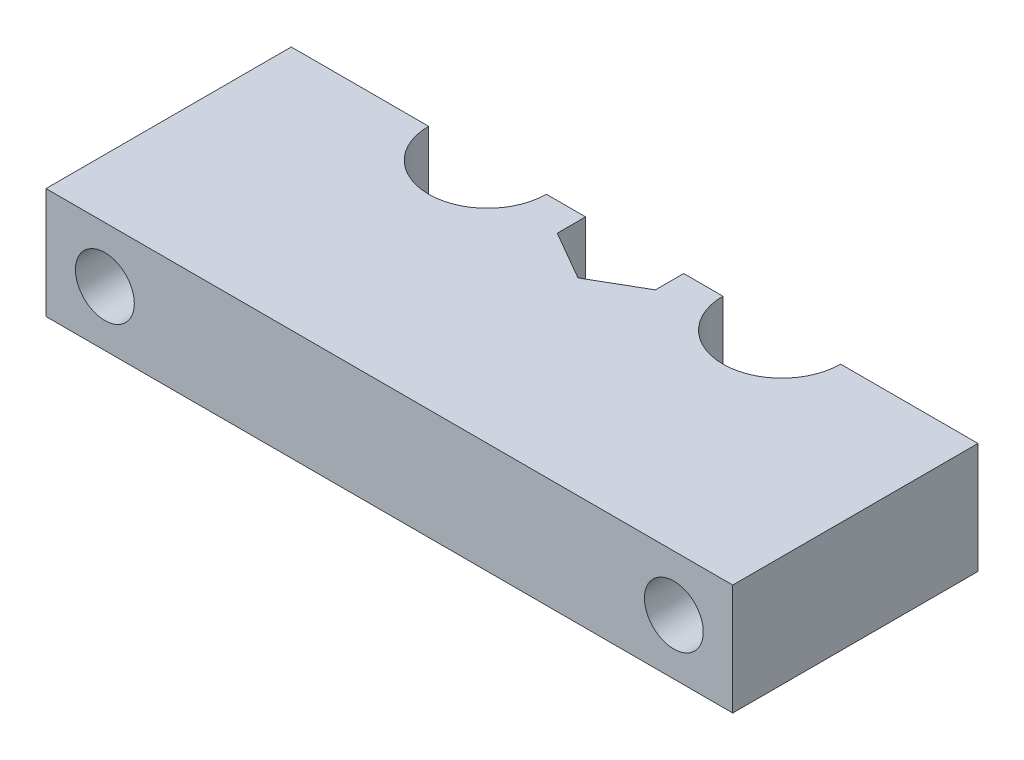
from build123d import *

# Parameters (mm, degrees)
BOSS_EXTRUDE1_DEPTH = 11.3
SKETCH2_R           = 3
CUT_EXTRUDE1_DEPTH  = 76.184373376


with BuildPart() as part:
    # Sketch1 → Boss-Extrude1 (new body)
    with BuildSketch(Plane(origin=(0, 0, 0), x_dir=(1, 0, 0), z_dir=(0, 1, 0))):
        with BuildLine():
            Line((56, 25), (70, 25))
            Line((70, 25), (70, 0))
            Line((70, 0), (0, 0))
            Line((0, 0), (0, 25))
            Line((0, 25), (14, 25))
            ThreePointArc((14, 25), (20, 19), (26, 25))
            Line((26, 25), (30, 25))
            Line((30, 25), (30, 22.113248654))
            Line((30, 22.113248654), (35, 19.226497308))
            Line((35, 19.226497308), (40, 22.113248654))
            Line((40, 22.113248654), (40, 25))
            Line((40, 25), (44, 25))
            ThreePointArc((44, 25), (50, 19), (56, 25))
        make_face()
    extrude(amount=BOSS_EXTRUDE1_DEPTH)

    # Sketch2 → Cut-Extrude1 (cut, through all)
    with BuildSketch(Plane.XY):
        with Locations((6, 5.65)):
            Circle(SKETCH2_R)
        with Locations((64, 5.65)):
            Circle(SKETCH2_R)
    extrude(amount=-CUT_EXTRUDE1_DEPTH, mode=Mode.SUBTRACT)


solid = part.part
